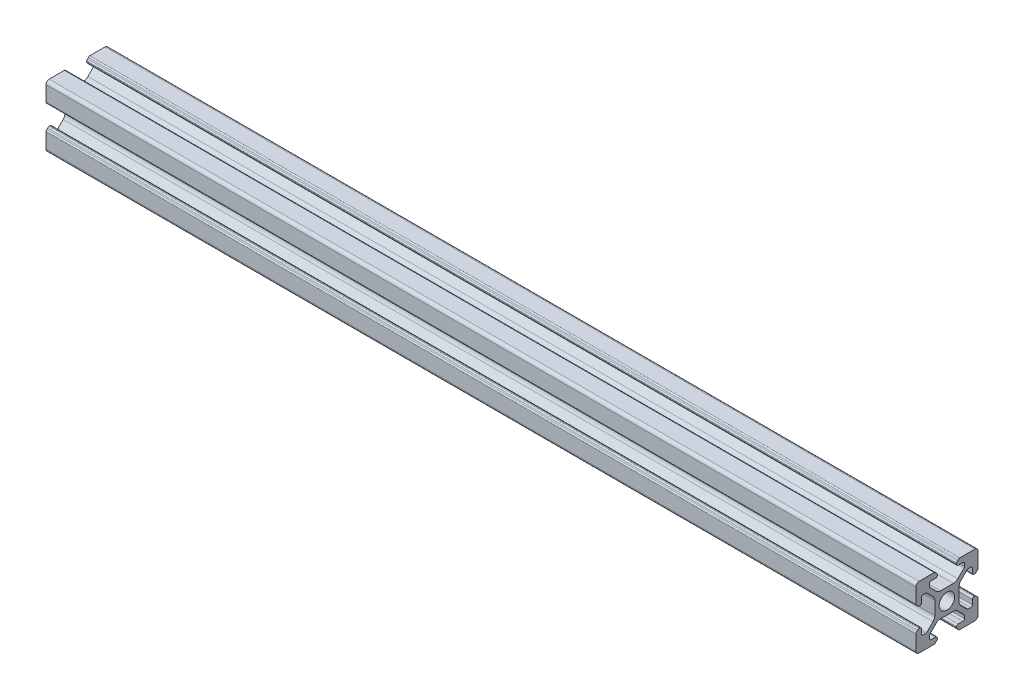
from build123d import *

# Parameters (mm, degrees)
SKETCH1_W                = 20
SKETCH1_H                = 20
BOSS_EXTRUDE1_DEPTH      = 280
FILLET1_R                = 1
CUT_EXTRUDE1_DEPTH       = 281.356915378
F_5_0_5_DIAMETER_HOLE1_D = 5
FILLET2_R                = 2
FILLET3_R                = 0.5
FILLET4_R                = 0.5
FILLET5_R                = 0.5


with BuildPart() as part:
    # Sketch1 → Boss-Extrude1 (new body)
    with BuildSketch(Plane(origin=(0, 0, 0), x_dir=(0, 0, -1), z_dir=(1, 0, 0))):
        Rectangle(SKETCH1_W, SKETCH1_H)
    extrude(amount=BOSS_EXTRUDE1_DEPTH)

    # Fillet1
    fillet1_edges = [part.edges().sort_by_distance(p)[0] for p in [
        (140, 10, 10),
        (140, 10, -10),
        (140, -10, -10),
        (140, -10, 10),
    ]]
    fillet(fillet1_edges, radius=FILLET1_R)

    # Sketch3 → Cut-Extrude1 (cut, through all)
    with BuildSketch(Plane.ZY):
        Polygon((-3.6, 10), (3.6, 10), (3.6, 9.5), (3.1, 9.5), (3.1, 8.2), (5.63, 8.2), (5.63, 6.619949494), (2.910050506, 3.9), (-2.910050506, 3.9), (-5.63, 6.619949494), (-5.63, 8.2), (-3.1, 8.2), (-3.1, 9.5), (-3.6, 9.5), align=None)
        Polygon((10, 3.6), (10, -3.6), (9.5, -3.6), (9.5, -3.1), (8.2, -3.1), (8.2, -5.63), (6.619949494, -5.63), (3.9, -2.910050506), (3.9, 2.910050506), (6.619949494, 5.63), (8.2, 5.63), (8.2, 3.1), (9.5, 3.1), (9.5, 3.6), align=None)
        Polygon((3.6, -10), (-3.6, -10), (-3.6, -9.5), (-3.1, -9.5), (-3.1, -8.2), (-5.63, -8.2), (-5.63, -6.619949494), (-2.910050506, -3.9), (2.910050506, -3.9), (5.63, -6.619949494), (5.63, -8.2), (3.1, -8.2), (3.1, -9.5), (3.6, -9.5), align=None)
        Polygon((-10, -3.6), (-10, 3.6), (-9.5, 3.6), (-9.5, 3.1), (-8.2, 3.1), (-8.2, 5.63), (-6.619949494, 5.63), (-3.9, 2.910050506), (-3.9, -2.910050506), (-6.619949494, -5.63), (-8.2, -5.63), (-8.2, -3.1), (-9.5, -3.1), (-9.5, -3.6), align=None)
    extrude(amount=-CUT_EXTRUDE1_DEPTH, mode=Mode.SUBTRACT)

    # Ø5.0 (5) Diameter Hole1 (through all)
    with Locations(Plane.ZY):
        with Locations((0, 0)):
            Hole(F_5_0_5_DIAMETER_HOLE1_D / 2)

    # Fillet2
    fillet2_edges = [part.edges().sort_by_distance(p)[0] for p in [
        (140, -3.9, -2.910050506),
        (140, -3.9, 2.910050506),
        (140, 2.910050506, -3.9),
        (140, -2.910050506, -3.9),
        (140, -2.910050506, 3.9),
        (140, 2.910050506, 3.9),
        (140, 3.9, 2.910050506),
        (140, 3.9, -2.910050506),
    ]]
    fillet(fillet2_edges, radius=FILLET2_R)

    # Fillet3
    fillet3_edges = [part.edges().sort_by_distance(p)[0] for p in [
        (140, 3.6, -10),
        (140, 3.1, -9.5),
        (140, 3.1, -8.2),
        (140, 5.63, -8.2),
        (140, 5.63, -6.619949494),
        (140, 3.6, 10),
        (140, 3.1, 9.5),
        (140, 3.1, 8.2),
        (140, 5.63, 8.2),
        (140, 5.63, 6.619949494),
        (140, 6.619949494, 5.63),
        (140, 8.2, 5.63),
        (140, 8.2, 3.1),
        (140, 9.5, 3.1),
        (140, 10, 3.6),
        (140, 9.5, -3.1),
        (140, 10, -3.6),
        (140, 8.2, -3.1),
        (140, 8.2, -5.63),
        (140, 6.619949494, -5.63),
    ]]
    fillet(fillet3_edges, radius=FILLET3_R - 0.0001)  # a hair under: the kernel refuses the full size

    # Fillet4
    fillet4_edges = [part.edges().sort_by_distance(p)[0] for p in [
        (140, -3.6, 10),
        (140, -3.1, 9.5),
        (140, -3.1, 8.2),
        (140, -5.63, 8.2),
        (140, -5.63, 6.619949494),
        (140, -6.619949494, 5.63),
        (140, -8.2, 5.63),
        (140, -8.2, 3.1),
        (140, -10, 3.6),
        (140, -9.5, 3.1),
        (140, -10, -3.6),
        (140, -9.5, -3.1),
        (140, -8.2, -3.1),
        (140, -8.2, -5.63),
        (140, -6.619949494, -5.63),
        (140, -5.63, -6.619949494),
        (140, -5.63, -8.2),
        (140, -3.1, -8.2),
        (140, -3.1, -9.5),
        (140, -3.6, -10),
    ]]
    fillet(fillet4_edges, radius=FILLET4_R - 0.0001)  # a hair under: the kernel refuses the full size

    # Fillet5
    fillet5_edges = [part.edges().sort_by_distance(p)[0] for p in [
        (140, 3.6, 9.5),
        (140, 9.5, 3.6),
        (140, 9.5, -3.6),
        (140, 3.6, -9.5),
        (140, -3.6, 9.5),
        (140, -9.5, 3.6),
        (140, -9.5, -3.6),
        (140, -3.6, -9.5),
    ]]
    fillet(fillet5_edges, radius=FILLET5_R)


solid = part.part
